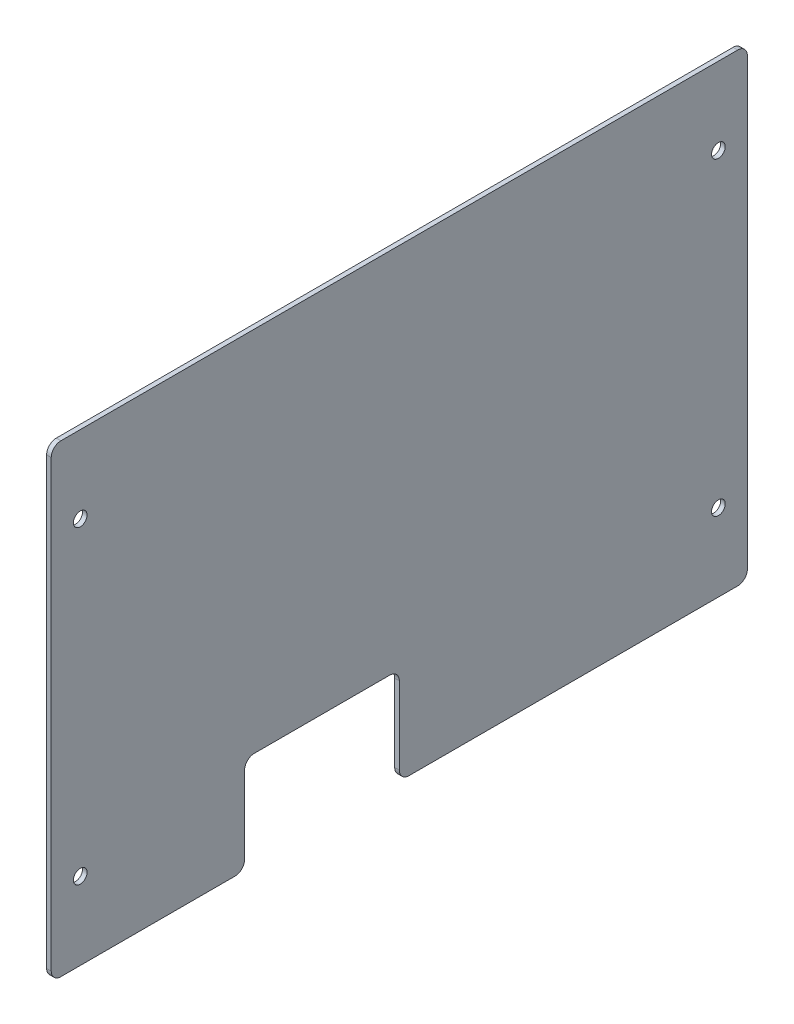
from build123d import *

# Parameters (mm, degrees)
BASE_FLANGE1_DEPTH   = 3.03784
M8_CLEARANCE_HOLE1_D = 9


# Sheet-metal steps are written as plain solids
with BuildPart() as part:
    # Sketch1 → Base-Flange1 (new body)
    with BuildSketch(Plane(origin=(0, 0, 0), x_dir=(0, 0, -1), z_dir=(1, 0, 0))):
        with BuildLine():
            Line((-107.95, -152.4), (-222.25, -152.4))
            ThreePointArc((-222.25, -152.4), (-226.740128061, -150.540128061), (-228.6, -146.05))
            Line((-228.6, -146.05), (-228.6, 146.05))
            ThreePointArc((-228.6, 146.05), (-226.740128061, 150.540128061), (-222.25, 152.4))
            Line((-222.25, 152.4), (222.25, 152.4))
            ThreePointArc((222.25, 152.4), (226.740128061, 150.540128061), (228.6, 146.05))
            Line((228.6, 146.05), (228.6, -146.05))
            ThreePointArc((228.6, -146.05), (226.740128061, -150.540128061), (222.25, -152.4))
            Line((222.25, -152.4), (6.35, -152.4))
            ThreePointArc((6.35, -152.4), (1.859871939, -150.540128061), (0, -146.05))
            Line((0, -146.05), (0, -95.25))
            ThreePointArc((0, -95.25), (-1.859871939, -90.759871939), (-6.35, -88.9))
            Line((-6.35, -88.9), (-95.25, -88.9))
            ThreePointArc((-95.25, -88.9), (-99.740128061, -90.759871939), (-101.6, -95.25))
            Line((-101.6, -95.25), (-101.6, -146.05))
            ThreePointArc((-101.6, -146.05), (-103.459871939, -150.540128061), (-107.95, -152.4))
        make_face()
    extrude(amount=-BASE_FLANGE1_DEPTH)

    # M8 Clearance Hole1 (through all)
    with Locations(Plane(origin=(0, 0, 0), x_dir=(0, 0, -1), z_dir=(1, 0, 0))):
        with Locations((-209.55, 101.6), (-209.55, -101.6), (209.55, -101.6), (209.55, 101.6)):
            Hole(M8_CLEARANCE_HOLE1_D / 2)


solid = part.part
